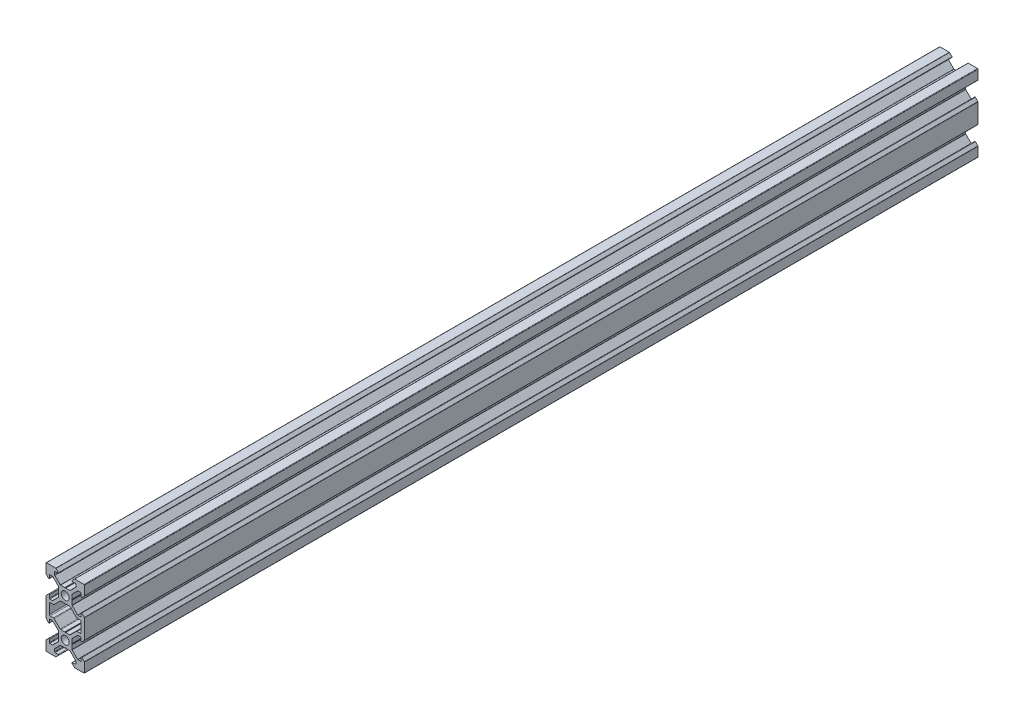
from build123d import *

# Parameters (mm, degrees)
SKETCH1_R           = 2.1
BOSS_EXTRUDE1_DEPTH = 465
FILLET1_R           = 0.25
FILLET2_R           = 0.5
CUT_EXTRUDE1_DEPTH  = 467.074028455


with BuildPart() as part:
    # Sketch1 → Boss-Extrude1 (new body)
    with BuildSketch(Plane.XY):
        Polygon((3.560660172, -2.5), (3.560660172, 2.5), (6.560660172, 5.5), (8.252142372, 5.5), (8.252142372, 3.1), (10, 4.847857628), (10, 10), (4.847857628, 10), (3.1, 8.252142372), (5.5, 8.252142372), (5.5, 6.560660172), (2.5, 3.560660172), (-2.5, 3.560660172), (-5.5, 6.560660172), (-5.5, 8.252142372), (-3.1, 8.252142372), (-4.847857628, 10), (-10, 10), (-10, 4.847857628), (-8.252142372, 3.1), (-8.252142372, 5.5), (-6.560660172, 5.5), (-3.560660172, 2.5), (-3.560660172, -2.5), (-6.560660172, -5.5), (-8.252142372, -5.5), (-8.252142372, -3.1), (-10, -4.847857628), (-10, -7), (-10, -13), (-10, -15.152142372), (-8.252142372, -16.9), (-8.252142372, -14.5), (-6.560660172, -14.5), (-3.560660172, -17.5), (-3.560660172, -22.5), (-6.560660172, -25.5), (-8.252142372, -25.5), (-8.252142372, -23.1), (-10, -24.847857628), (-10, -30), (-4.847857628, -30), (-3.1, -28.252142372), (-5.5, -28.252142372), (-5.5, -26.560660172), (-2.5, -23.560660172), (2.5, -23.560660172), (5.5, -26.560660172), (5.5, -28.252142372), (3.1, -28.252142372), (4.847857628, -30), (10, -30), (10, -24.847857628), (8.252142372, -23.1), (8.252142372, -25.5), (6.560660172, -25.5), (3.560660172, -22.5), (3.560660172, -17.5), (6.560660172, -14.5), (8.252142372, -14.5), (8.252142372, -16.9), (10, -15.152142372), (10, -13), (10, -7), (10, -4.847857628), (8.252142372, -3.1), (8.252142372, -5.5), (6.560660172, -5.5), align=None)
        Circle(SKETCH1_R, mode=Mode.SUBTRACT)
        with Locations((0, -20)):
            Circle(SKETCH1_R, mode=Mode.SUBTRACT)
        Polygon((2.5, -3.560660172), (-2.5, -3.560660172), (-5.5, -6.560660172), (-5.939339828, -7), (-8.252142372, -7), (-8.252142372, -13), (-5.939339828, -13), (-5.5, -13.439339828), (-2.5, -16.439339828), (2.5, -16.439339828), (5.5, -13.439339828), (5.939339828, -13), (8.252142372, -13), (8.252142372, -7), (5.939339828, -7), (5.5, -6.560660172), align=None, mode=Mode.SUBTRACT)
    extrude(amount=BOSS_EXTRUDE1_DEPTH)

    # Fillet1
    fillet1_edges = [part.edges().sort_by_distance(p)[0] for p in [
        (5.5, 6.560660172, 232.5),
        (5.5, 8.252142372, 232.5),
        (3.1, 8.252142372, 232.5),
        (4.847857628, 10, 232.5),
        (10, 10, 232.5),
        (10, 4.847857628, 232.5),
        (8.252142372, 3.1, 232.5),
        (8.252142372, 5.5, 232.5),
        (6.560660172, 5.5, 232.5),
        (3.560660172, 2.5, 232.5),
        (3.560660172, -2.5, 232.5),
        (6.560660172, -5.5, 232.5),
        (8.252142372, -5.5, 232.5),
        (8.252142372, -3.1, 232.5),
        (10, -4.847857628, 232.5),
        (10, -15.152142372, 232.5),
        (8.252142372, -16.9, 232.5),
        (8.252142372, -14.5, 232.5),
        (6.560660172, -14.5, 232.5),
        (3.560660172, -17.5, 232.5),
        (3.560660172, -22.5, 232.5),
        (6.560660172, -25.5, 232.5),
        (8.252142372, -25.5, 232.5),
        (8.252142372, -23.1, 232.5),
        (10, -24.847857628, 232.5),
        (10, -30, 232.5),
        (4.847857628, -30, 232.5),
        (3.1, -28.252142372, 232.5),
        (5.5, -28.252142372, 232.5),
        (5.5, -26.560660172, 232.5),
        (2.5, -23.560660172, 232.5),
        (-2.5, -23.560660172, 232.5),
        (-5.5, -26.560660172, 232.5),
        (-5.5, -28.252142372, 232.5),
        (-3.1, -28.252142372, 232.5),
        (-4.847857628, -30, 232.5),
        (-10, -30, 232.5),
        (-10, -24.847857628, 232.5),
        (-8.252142372, -23.1, 232.5),
        (-8.252142372, -25.5, 232.5),
        (-6.560660172, -25.5, 232.5),
        (-3.560660172, -22.5, 232.5),
        (-3.560660172, -17.5, 232.5),
        (-6.560660172, -14.5, 232.5),
        (-8.252142372, -14.5, 232.5),
        (-8.252142372, -16.9, 232.5),
        (-10, -15.152142372, 232.5),
        (-10, -4.847857628, 232.5),
        (-8.252142372, -3.1, 232.5),
        (-8.252142372, -5.5, 232.5),
        (-6.560660172, -5.5, 232.5),
        (-3.560660172, -2.5, 232.5),
        (-3.560660172, 2.5, 232.5),
        (-6.560660172, 5.5, 232.5),
        (-8.252142372, 5.5, 232.5),
        (-8.252142372, 3.1, 232.5),
        (-10, 4.847857628, 232.5),
        (-10, 10, 232.5),
        (-4.847857628, 10, 232.5),
        (-5.5, 8.252142372, 232.5),
        (-5.5, 6.560660172, 232.5),
        (-2.5, 3.560660172, 232.5),
        (2.5, 3.560660172, 232.5),
        (-3.1, 8.252142372, 232.5),
    ]]
    fillet(fillet1_edges, radius=FILLET1_R)

    # Fillet2
    fillet2_edges = [part.edges().sort_by_distance(p)[0] for p in [
        (-5.939339828, -7, 232.5),
        (-8.252142372, -7, 232.5),
        (-8.252142372, -13, 232.5),
        (-5.939339828, -13, 232.5),
        (-2.5, -16.439339828, 232.5),
        (2.5, -16.439339828, 232.5),
        (8.252142372, -7, 232.5),
        (5.939339828, -7, 232.5),
        (2.5, -3.560660172, 232.5),
        (-2.5, -3.560660172, 232.5),
        (5.939339828, -13, 232.5),
        (8.252142372, -13, 232.5),
    ]]
    fillet(fillet2_edges, radius=FILLET2_R)

    # Sketch2 → Cut-Extrude1 (cut, through all)
    with BuildSketch(Plane.XY.offset(465)):
        Polygon((0, 3.398953432), (-0.242280927, 3.560660172), (0.242280927, 3.560660172), align=None)
        Polygon((0, -3.398953432), (0.242280927, -3.560660172), (-0.242280927, -3.560660172), align=None)
        Polygon((3.560660172, 0.242280927), (3.560660172, -0.242280927), (3.398953432, 0), align=None)
        Polygon((-3.560660172, 0.242280927), (-3.560660172, -0.242280927), (-3.398953432, 0), align=None)
        Polygon((-3.398953432, -20), (-3.560660172, -20.242280927), (-3.560660172, -19.757719073), align=None)
        Polygon((3.398953432, -20), (3.560660172, -19.757719073), (3.560660172, -20.242280927), align=None)
        Polygon((-0.242280927, -16.439339828), (0.242280927, -16.439339828), (0, -16.601046568), align=None)
        Polygon((-0.242280927, -23.560660172), (0.242280927, -23.560660172), (0, -23.398953432), align=None)
    extrude(amount=-CUT_EXTRUDE1_DEPTH, mode=Mode.SUBTRACT)


solid = part.part
